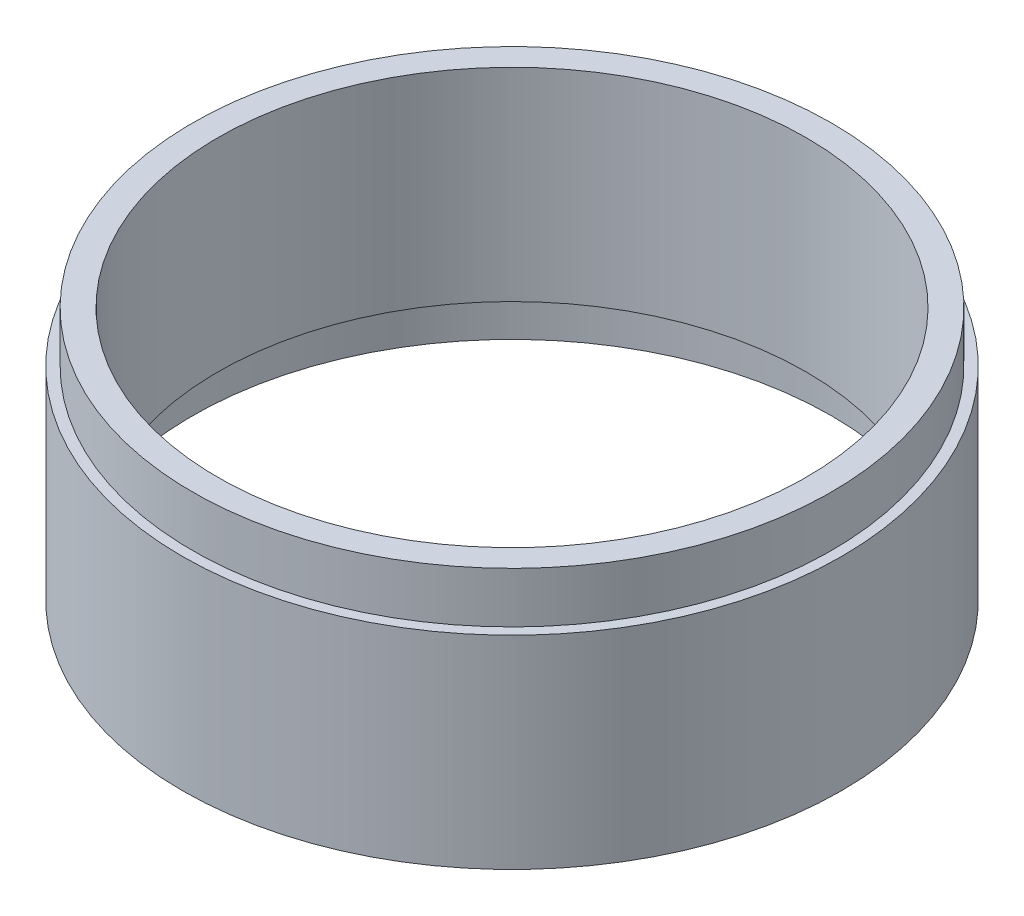
from build123d import *


with BuildPart() as part:
    # Szkic1 → Obrót1 (revolve)
    with BuildSketch(Plane.XY):
        Polygon((-65, 0), (-63, 0), (-63, 10), (-58, 10), (-58, 50), (-63, 50), (-63, 40), (-65, 40), (-65, 10), align=None)
    revolve(axis=Axis((0, 0, 0), (0, 1, 0)))


solid = part.part
